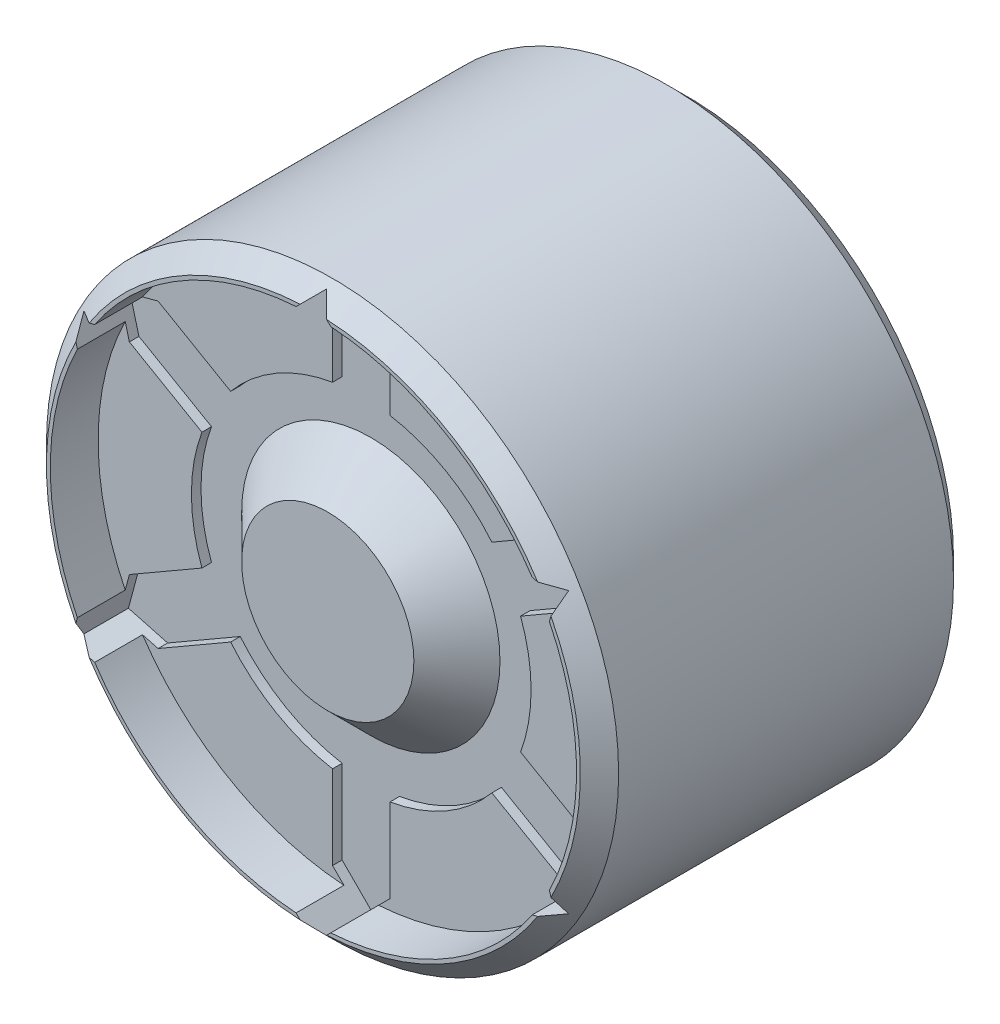
from build123d import *

# Parameters (mm, degrees)
SKETCH_1_R          = 5.98
EXTRUDE_1_DEPTH     = 0.2
SKETCH_2_R          = 2.8
EXTRUDE_2_DEPTH     = 0.9
SKETCH_3_R          = 5.98
EXTRUDE_3_DEPTH     = 1
EXTRUDE_START       = -0.6
SKETCH_4_R          = 5.98
EXTRUDE_4_DEPTH     = 0.6
CUT_EXTRUDE_START   = -0.2
SKETCH_6_R          = 3.55
SKETCH_6_R_2        = 2.8
CUT_EXTRUDE_2_DEPTH = 0.2
EXTRUDE_START_2     = 6
SKETCH_7_R          = 5.98
SKETCH_7_R_2        = 5.25
EXTRUDE_5_DEPTH     = 6
CHAMFER_4_SIZE      = 1
CHAMFER_5_SIZE      = 0.4
CHAMFER_6_SIZE      = 0.4
CHAMFER_7_SIZE      = 1


with BuildPart() as part:
    # 스케치1 → 보스-돌출1 (new body)
    with BuildSketch(Plane.XY):
        Circle(SKETCH_1_R)
        with BuildLine():
            Line((-0.6, 5.25), (0, 5.85))
            Line((0, 5.85), (0.6, 5.25))
            Line((0.6, 5.25), (0.6, 1.670516387))
            ThreePointArc((0.6, 1.670516387), (0.8875, 1.537195092), (1.146709629, 1.354873436))
            Line((1.146709629, 1.354873436), (4.24663337, 3.144615242))
            Line((4.24663337, 3.144615242), (5.066248612, 2.925))
            Line((5.066248612, 2.925), (4.84663337, 2.105384758))
            Line((4.84663337, 2.105384758), (1.746709629, 0.315642951))
            ThreePointArc((1.746709629, 0.315642951), (1.76791326, 0.158454108), (1.775, 0))
            ThreePointArc((1.775, 0), (1.76791326, -0.158454108), (1.746709629, -0.315642951))
            Line((1.746709629, -0.315642951), (4.84663337, -2.105384758))
            Line((4.84663337, -2.105384758), (5.066248612, -2.925))
            Line((5.066248612, -2.925), (4.24663337, -3.144615242))
            Line((4.24663337, -3.144615242), (1.146709629, -1.354873436))
            ThreePointArc((1.146709629, -1.354873436), (0.8875, -1.537195092), (0.6, -1.670516387))
            Line((0.6, -1.670516387), (0.6, -5.25))
            Line((0.6, -5.25), (0, -5.85))
            Line((0, -5.85), (-0.6, -5.25))
            Line((-0.6, -5.25), (-0.6, -1.670516387))
            ThreePointArc((-0.6, -1.670516387), (-0.8875, -1.537195092), (-1.146709629, -1.354873436))
            Line((-1.146709629, -1.354873436), (-4.24663337, -3.144615242))
            Line((-4.24663337, -3.144615242), (-5.066248612, -2.925))
            Line((-5.066248612, -2.925), (-4.84663337, -2.105384758))
            Line((-4.84663337, -2.105384758), (-1.746709629, -0.315642951))
            ThreePointArc((-1.746709629, -0.315642951), (-1.775, 0), (-1.746709629, 0.315642951))
            Line((-1.746709629, 0.315642951), (-4.84663337, 2.105384758))
            Line((-4.84663337, 2.105384758), (-5.066248612, 2.925))
            Line((-5.066248612, 2.925), (-4.24663337, 3.144615242))
            Line((-4.24663337, 3.144615242), (-1.146709629, 1.354873436))
            ThreePointArc((-1.146709629, 1.354873436), (-0.8875, 1.537195092), (-0.6, 1.670516387))
            Line((-0.6, 1.670516387), (-0.6, 5.25))
        make_face(mode=Mode.SUBTRACT)
    extrude(amount=EXTRUDE_1_DEPTH)

    # 스케치3 → 보스-돌출3 (add)
    with BuildSketch(Plane.XY.offset(0.2)):
        Circle(SKETCH_3_R)
        with BuildLine():
            Line((-4.933776406, -2.430606997), (-5.066248612, -2.925))
            Line((-5.066248612, -2.925), (-4.571855609, -3.057472206))
            ThreePointArc((-4.571855609, -3.057472206), (-2.75, -4.763139721), (-0.361920797, -5.488079203))
            Line((-0.361920797, -5.488079203), (0, -5.85))
            Line((0, -5.85), (0.361920797, -5.488079203))
            ThreePointArc((0.361920797, -5.488079203), (2.75, -4.763139721), (4.571855609, -3.057472206))
            Line((4.571855609, -3.057472206), (5.066248612, -2.925))
            Line((5.066248612, -2.925), (4.933776406, -2.430606997))
            ThreePointArc((4.933776406, -2.430606997), (5.5, 0), (4.933776406, 2.430606997))
            Line((4.933776406, 2.430606997), (5.066248612, 2.925))
            Line((5.066248612, 2.925), (4.571855609, 3.057472206))
            ThreePointArc((4.571855609, 3.057472206), (2.75, 4.763139721), (0.361920797, 5.488079203))
            Line((0.361920797, 5.488079203), (0, 5.85))
            Line((0, 5.85), (-0.361920797, 5.488079203))
            ThreePointArc((-0.361920797, 5.488079203), (-2.75, 4.763139721), (-4.571855609, 3.057472206))
            Line((-4.571855609, 3.057472206), (-5.066248612, 2.925))
            Line((-5.066248612, 2.925), (-4.933776406, 2.430606997))
            ThreePointArc((-4.933776406, 2.430606997), (-5.5, 0), (-4.933776406, -2.430606997))
        make_face(mode=Mode.SUBTRACT)
    extrude(amount=EXTRUDE_3_DEPTH)



with BuildPart() as body_2:
    # 스케치2 → 보스-돌출2 (new body)
    with BuildSketch(Plane.XY):
        Circle(SKETCH_2_R)
    extrude(amount=EXTRUDE_2_DEPTH)


with BuildPart() as part_1:
    add(part.part)

    add(body_2.part)  # 보스-돌출4 merges body 2
    # 스케치4 → 보스-돌출4 (add)
    with BuildSketch(Plane.XY.offset(EXTRUDE_START)):
        Circle(SKETCH_4_R)
    extrude(amount=EXTRUDE_4_DEPTH)

    # 스케치6 → 컷-돌출2 (cut)
    with BuildSketch(Plane.XY.offset(0.2).offset(CUT_EXTRUDE_START)):
        Circle(SKETCH_6_R)
        Circle(SKETCH_6_R_2, mode=Mode.SUBTRACT)
    extrude(amount=CUT_EXTRUDE_2_DEPTH, mode=Mode.SUBTRACT)

    # 스케치7 → 보스-돌출5 (add)
    with BuildSketch(Plane(origin=(0, 0, -0.6), x_dir=(-1, 0, 0), z_dir=(0, 0, -1)).offset(EXTRUDE_START_2)):
        with Locations(Location((0, 0, 0), (0, 0, 180))):
            Circle(SKETCH_7_R)
        Circle(SKETCH_7_R_2, mode=Mode.SUBTRACT)
    extrude(amount=-EXTRUDE_5_DEPTH)

    # 모따기4
    chamfer_4_edges = [part_1.edges().sort_by_distance(p)[0] for p in [
        (5.25, 0, -0.6),
    ]]
    chamfer(chamfer_4_edges, length=CHAMFER_4_SIZE)

    # 모따기5
    # the kernel refuses this chamfer: 0.4 mm, written as the material it takes off along each edge
    with BuildSketch(Plane(origin=(0, 0, 1.2), x_dir=(1, 0, 0), z_dir=(0, -1, 0))) as chamfer_5_piece_1:
        Polygon((5.98, -CHAMFER_5_SIZE), (5.98 - CHAMFER_5_SIZE, 0), (5.98, 0), align=None)
    revolve(axis=Axis((0, 0, 1.2), (0, 0, 1)), mode=Mode.SUBTRACT)

    # 모따기6
    chamfer_6_edges = [part_1.edges().sort_by_distance(p)[0] for p in [
        (-5.98, 0, -6.6),
    ]]
    chamfer(chamfer_6_edges, length=CHAMFER_6_SIZE)

    # 모따기7
    # the kernel refuses this chamfer: 1 mm, written as the material it takes off along each edge
    with BuildSketch(Plane(origin=(0, 0, 0.9), x_dir=(1, 0, 0), z_dir=(0, -1, 0))) as chamfer_7_piece_1_section:
        Polygon((2.8, -CHAMFER_7_SIZE), (2.8 - CHAMFER_7_SIZE, 0), (2.8, 0), align=None)
    chamfer_7_piece_1 = revolve(axis=Axis((0, 0, 0.9), (0, 0, 1)), mode=Mode.PRIVATE)
    chamfer_7_piece_1 = split(chamfer_7_piece_1, bisect_by=Plane(origin=(-2.250209939, 0, 0), z_dir=(0, 0, 1)), keep=Keep.TOP, mode=Mode.PRIVATE)
    add(chamfer_7_piece_1, mode=Mode.SUBTRACT)


solid = part_1.part
